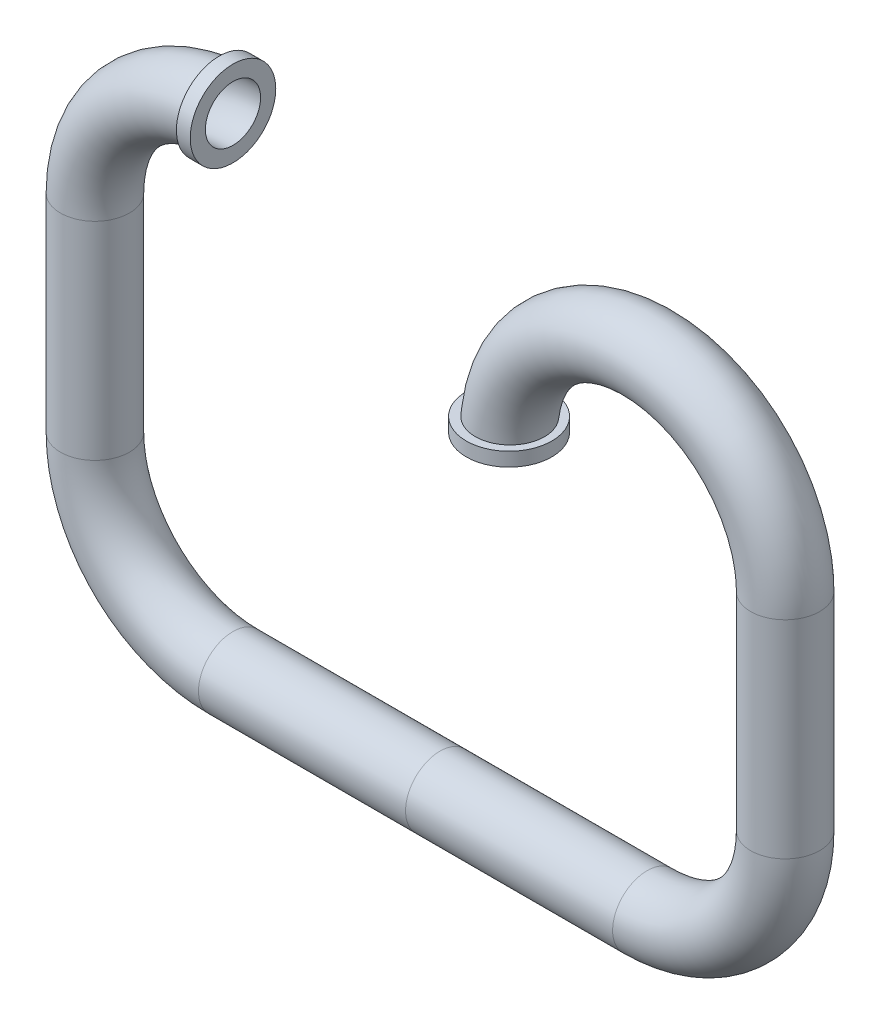
from build123d import *

# Parameters (mm, degrees)
SKETCH3_R        = 0.25
SKETCH3_R_2      = 0.2
SKETCH6_R        = 0.31
SKETCH6_R_2      = 0.21
SPLIT2_START     = -1
SPLIT2_OUTLINE_W = 3
SPLIT2_OUTLINE_H = 4
SPLIT2_DEPTH     = 1.31
SKETCH10_R       = 0.31
SKETCH10_R_2     = 0.21


# Read off the part's stored shape, not the designer's step: Split1, Split2
with BuildPart() as part:
    # Sweep-Thin1: sweep along a path in Sketch1
    with BuildLine(Plane.XY) as sweep_thin1_path:
        Line((0.5, -2.5), (-1, -2.5))
        ThreePointArc((-1, -2.5), (-1.707106781, -2.207106781), (-2, -1.5))
        Line((-2, -1.5), (-2, 0))
        ThreePointArc((-2, 0), (-1, 1), (0, 0))
    # Sketch3 → Sweep-Thin1 (sweep)
    with BuildSketch(Plane(origin=(0, 0, 0), x_dir=(1, 0, 0), z_dir=(0, 1, 0))):
        Circle(SKETCH3_R)
        Circle(SKETCH3_R_2, mode=Mode.SUBTRACT)
    sweep(path=sweep_thin1_path.line)

    # Sweep-Thin2: sweep along a path in Sketch5
    with BuildLine(Plane.XY) as sweep_thin2_path:
        Line((0, 0), (0, 0.1))
    # Sketch6 → Sweep-Thin2 (sweep)
    with BuildSketch(Plane(origin=(0, 0, 0), x_dir=(1, 0, 0), z_dir=(0, 1, 0))):
        Circle(SKETCH6_R)
        Circle(SKETCH6_R_2, mode=Mode.SUBTRACT)
    sweep(path=sweep_thin2_path.line)

    # Mirror2: part across plane


with BuildPart() as part_1:
    add(part.part)
    add(part.part.mirror(Plane(origin=(0.5, -2.5, 0), x_dir=(0, 0, 1), z_dir=(1, 0, 0))))


with BuildPart() as body_2:
    # Split1: the piece on the far side of the plane
    add(part_1.part)
    split(bisect_by=Plane.YZ.offset(0.5), keep=Keep.BOTTOM)

    # Split2 outline → Split2 (cut)
    with BuildSketch(Plane.YZ.offset(SPLIT2_START)):
        with Locations((1.5, 0)):
            Rectangle(SPLIT2_OUTLINE_W, SPLIT2_OUTLINE_H)
    extrude(amount=SPLIT2_DEPTH, mode=Mode.SUBTRACT)

    # Sweep-Thin3: sweep along a path in Sketch11
    with BuildLine(Plane(origin=(0, 1, 0), x_dir=(1, 0, 0), z_dir=(0, 1, 0))) as sweep_thin3_path:
        Line((-1, 0), (-1.1, 0))
    # Sketch10 → Sweep-Thin3 (sweep)
    with BuildSketch(Plane(origin=(-1, 0, 0), x_dir=(0, 0, -1), z_dir=(1, 0, 0))):
        with Locations((0, 1)):
            Circle(SKETCH10_R)
        with Locations((0, 1)):
            Circle(SKETCH10_R_2, mode=Mode.SUBTRACT)
    sweep(path=sweep_thin3_path.line)


with BuildPart() as part_2:
    add(part_1.part)

    # Split1
    split(bisect_by=Plane.YZ.offset(0.5), keep=Keep.TOP)


solid = Compound([body_2.part, part_2.part])
